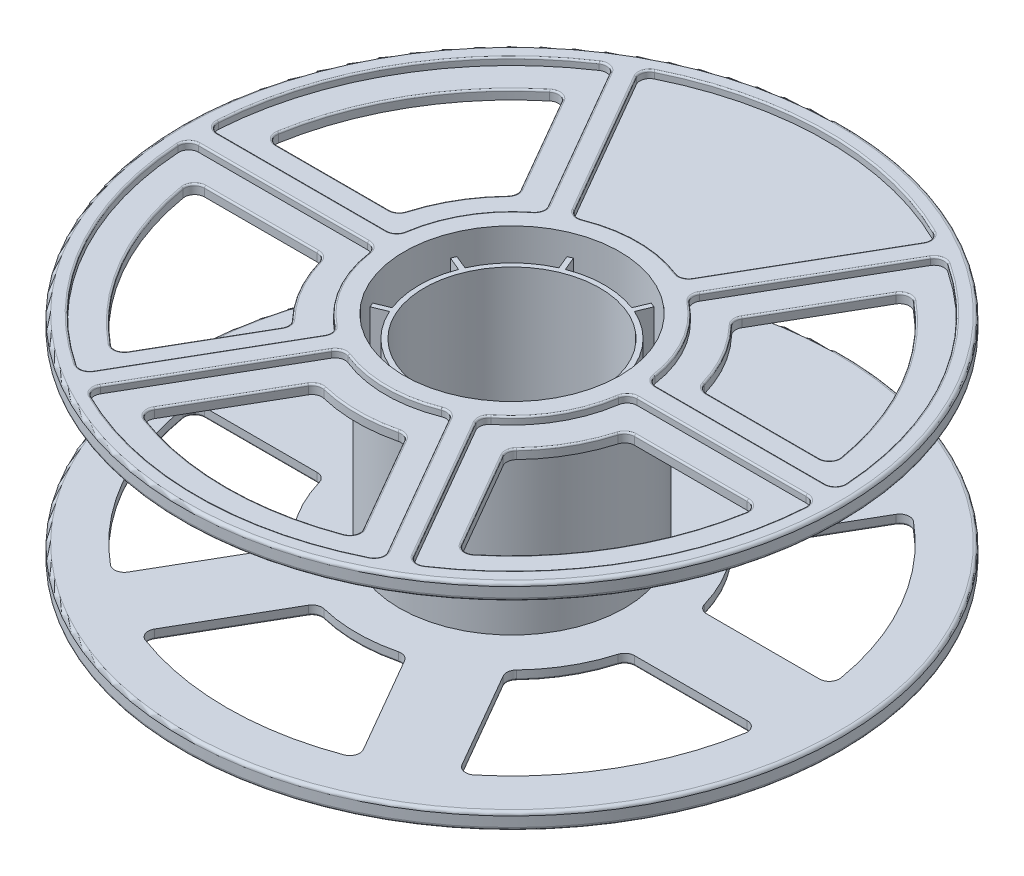
from build123d import *

# Parameters (mm, degrees)
SKETCH2_W                = 1.5
SKETCH2_H                = 52
INNER_START              = -52
INNER_RING_RIBS_DEPTH    = 52
TOP_PANEL_INSET_DEPTH    = 2.2
BOTTOM_START             = -2.2
BOTTOM_PANEL_INSET_DEPTH = 2.2
PANEL_CUTOUTS_DEPTH      = 155.091985515
UPPER_EDGE_FILLET_R      = 0.5
OUTER_RING_FILLET_R      = 1
PANEL_INSET_FILLET_R     = 0.5


with BuildPart() as part:
    # Sketch2 → Inner Ring (revolve)
    with BuildSketch(Plane.XY):
        with Locations((27.25, 0)):
            Rectangle(SKETCH2_W, SKETCH2_H)
    revolve(axis=Axis((0, -1000, 0), (0, 1, 0)))

    # Sketch3 → Inner Ring Ribs (add)
    with BuildSketch(Plane(origin=(0, 26, 0), x_dir=(1, 0, 0), z_dir=(0, 1, 0)).offset(INNER_START)):
        with BuildLine():
            Line((11.740989778, 30.305101205), (10.018381849, 26.146357779))
            ThreePointArc((10.018381849, 26.146357779), (10.715136106, 25.86862691), (11.404201147, 25.572332631))
            Line((11.404201147, 25.572332631), (13.126809077, 29.731076056))
            ThreePointArc((13.126809077, 29.731076056), (12.437211552, 30.026084807), (11.740989778, 30.305101205))
        make_face()
        with BuildLine():
            Line((29.731076056, 13.126809077), (25.572332631, 11.404201147))
            ThreePointArc((25.572332631, 11.404201147), (25.86862691, 10.715136106), (26.146357779, 10.018381849))
            Line((26.146357779, 10.018381849), (30.305101205, 11.740989778))
            ThreePointArc((30.305101205, 11.740989778), (30.026084807, 12.437211552), (29.731076056, 13.126809077))
        make_face()
        with BuildLine():
            Line((30.305101205, -11.740989778), (26.146357779, -10.018381849))
            ThreePointArc((26.146357779, -10.018381849), (25.86862691, -10.715136106), (25.572332631, -11.404201147))
            Line((25.572332631, -11.404201147), (29.731076056, -13.126809077))
            ThreePointArc((29.731076056, -13.126809077), (30.026084807, -12.437211552), (30.305101205, -11.740989778))
        make_face()
        with BuildLine():
            Line((13.126809077, -29.731076056), (11.404201147, -25.572332631))
            ThreePointArc((11.404201147, -25.572332631), (10.715136106, -25.86862691), (10.018381849, -26.146357779))
            Line((10.018381849, -26.146357779), (11.740989778, -30.305101205))
            ThreePointArc((11.740989778, -30.305101205), (12.437211552, -30.026084807), (13.126809077, -29.731076056))
        make_face()
        with BuildLine():
            Line((-11.740989778, -30.305101205), (-10.018381849, -26.146357779))
            ThreePointArc((-10.018381849, -26.146357779), (-10.715136106, -25.86862691), (-11.404201147, -25.572332631))
            Line((-11.404201147, -25.572332631), (-13.126809077, -29.731076056))
            ThreePointArc((-13.126809077, -29.731076056), (-12.437211552, -30.026084807), (-11.740989778, -30.305101205))
        make_face()
        with BuildLine():
            Line((-29.731076056, -13.126809077), (-25.572332631, -11.404201147))
            ThreePointArc((-25.572332631, -11.404201147), (-25.86862691, -10.715136106), (-26.146357779, -10.018381849))
            Line((-26.146357779, -10.018381849), (-30.305101205, -11.740989778))
            ThreePointArc((-30.305101205, -11.740989778), (-30.026084807, -12.437211552), (-29.731076056, -13.126809077))
        make_face()
        with BuildLine():
            Line((-30.305101205, 11.740989778), (-26.146357779, 10.018381849))
            ThreePointArc((-26.146357779, 10.018381849), (-25.86862691, 10.715136106), (-25.572332631, 11.404201147))
            Line((-25.572332631, 11.404201147), (-29.731076056, 13.126809077))
            ThreePointArc((-29.731076056, 13.126809077), (-30.026084807, 12.437211552), (-30.305101205, 11.740989778))
        make_face()
        with BuildLine():
            Line((-13.126809077, 29.731076056), (-11.404201147, 25.572332631))
            ThreePointArc((-11.404201147, 25.572332631), (-10.715136106, 25.86862691), (-10.018381849, 26.146357779))
            Line((-10.018381849, 26.146357779), (-11.740989778, 30.305101205))
            ThreePointArc((-11.740989778, 30.305101205), (-12.437211552, 30.026084807), (-13.126809077, 29.731076056))
        make_face()
    extrude(amount=INNER_RING_RIBS_DEPTH)

    # Sketch4 → Spool Panels (revolve)
    with BuildSketch(Plane.XY):
        Polygon((32.5, 32.5), (32.5, -32.5), (99.5, -32.5), (99.5, -27.5), (34, -27.5), (34, 27.5), (99.5, 27.5), (99.5, 32.5), align=None)
    revolve(axis=Axis((0, -1000, 0), (0, 1, 0)))

    # Sketch5 → Top Panel Inset (cut)
    with BuildSketch(Plane(origin=(0, 32.5, 0), x_dir=(1, 0, 0), z_dir=(0, 1, 0))):
        with BuildLine():
            Line((43.343733231, 80.873548145), (17.825684439, 36.674991128))
            ThreePointArc((17.825684439, 36.674991128), (16.210584243, 35.340602631), (14.116103978, 35.388495426))
            ThreePointArc((14.116103978, 35.388495426), (0, 38.1), (-14.116103978, 35.388495426))
            ThreePointArc((-14.116103978, 35.388495426), (-16.210584243, 35.340602631), (-17.825684439, 36.674991128))
            Line((-17.825684439, 36.674991128), (-43.343733231, 80.873548145))
            ThreePointArc((-43.343733231, 80.873548145), (-43.617002389, 83.24267171), (-42.075765518, 85.062564951))
            ThreePointArc((-42.075765518, 85.062564951), (0, 94.9), (42.075765518, 85.062564951))
            ThreePointArc((42.075765518, 85.062564951), (43.617002389, 83.24267171), (43.343733231, 80.873548145))
        make_face()
        with BuildLine():
            Line((91.710413803, 2.9), (40.67431622, 2.9))
            ThreePointArc((40.67431622, 2.9), (38.711151786, 3.631523551), (37.705388029, 5.469343066))
            ThreePointArc((37.705388029, 5.469343066), (32.995567884, 19.05), (23.589284051, 29.91915236))
            ThreePointArc((23.589284051, 29.91915236), (22.500567542, 31.709079081), (22.848631781, 33.774991128))
            Line((22.848631781, 33.774991128), (48.366680573, 77.973548145))
            ThreePointArc((48.366680573, 77.973548145), (50.281767186, 79.394767961), (52.628459399, 78.969964298))
            ThreePointArc((52.628459399, 78.969964298), (82.185810819, 47.45), (94.704224918, 6.092600653))
            ThreePointArc((94.704224918, 6.092600653), (93.898769574, 3.84790375), (91.710413803, 2.9))
        make_face()
        with BuildLine():
            Line((48.366680573, -77.973548145), (22.848631781, -33.774991128))
            ThreePointArc((22.848631781, -33.774991128), (22.500567542, -31.709079081), (23.589284051, -29.91915236))
            ThreePointArc((23.589284051, -29.91915236), (32.995567884, -19.05), (37.705388029, -5.469343066))
            ThreePointArc((37.705388029, -5.469343066), (38.711151786, -3.631523551), (40.67431622, -2.9))
            Line((40.67431622, -2.9), (91.710413803, -2.9))
            ThreePointArc((91.710413803, -2.9), (93.898769574, -3.84790375), (94.704224918, -6.092600653))
            ThreePointArc((94.704224918, -6.092600653), (82.185810819, -47.45), (52.628459399, -78.969964298))
            ThreePointArc((52.628459399, -78.969964298), (50.281767186, -79.394767961), (48.366680573, -77.973548145))
        make_face()
        with BuildLine():
            Line((-43.343733231, -80.873548145), (-17.825684439, -36.674991128))
            ThreePointArc((-17.825684439, -36.674991128), (-16.210584243, -35.340602631), (-14.116103978, -35.388495426))
            ThreePointArc((-14.116103978, -35.388495426), (0, -38.1), (14.116103978, -35.388495426))
            ThreePointArc((14.116103978, -35.388495426), (16.210584243, -35.340602631), (17.825684439, -36.674991128))
            Line((17.825684439, -36.674991128), (43.343733231, -80.873548145))
            ThreePointArc((43.343733231, -80.873548145), (43.617002389, -83.24267171), (42.075765518, -85.062564951))
            ThreePointArc((42.075765518, -85.062564951), (0, -94.9), (-42.075765518, -85.062564951))
            ThreePointArc((-42.075765518, -85.062564951), (-43.617002389, -83.24267171), (-43.343733231, -80.873548145))
        make_face()
        with BuildLine():
            Line((-91.710413803, -2.9), (-40.67431622, -2.9))
            ThreePointArc((-40.67431622, -2.9), (-38.711151786, -3.631523551), (-37.705388029, -5.469343066))
            ThreePointArc((-37.705388029, -5.469343066), (-32.995567884, -19.05), (-23.589284051, -29.91915236))
            ThreePointArc((-23.589284051, -29.91915236), (-22.500567542, -31.709079081), (-22.848631781, -33.774991128))
            Line((-22.848631781, -33.774991128), (-48.366680573, -77.973548145))
            ThreePointArc((-48.366680573, -77.973548145), (-50.281767186, -79.394767961), (-52.628459399, -78.969964298))
            ThreePointArc((-52.628459399, -78.969964298), (-82.185810819, -47.45), (-94.704224918, -6.092600653))
            ThreePointArc((-94.704224918, -6.092600653), (-93.898769574, -3.84790375), (-91.710413803, -2.9))
        make_face()
        with BuildLine():
            Line((-48.366680573, 77.973548145), (-22.848631781, 33.774991128))
            ThreePointArc((-22.848631781, 33.774991128), (-22.500567542, 31.709079081), (-23.589284051, 29.91915236))
            ThreePointArc((-23.589284051, 29.91915236), (-32.995567884, 19.05), (-37.705388029, 5.469343066))
            ThreePointArc((-37.705388029, 5.469343066), (-38.711151786, 3.631523551), (-40.67431622, 2.9))
            Line((-40.67431622, 2.9), (-91.710413803, 2.9))
            ThreePointArc((-91.710413803, 2.9), (-93.898769574, 3.84790375), (-94.704224918, 6.092600653))
            ThreePointArc((-94.704224918, 6.092600653), (-82.185810819, 47.45), (-52.628459399, 78.969964298))
            ThreePointArc((-52.628459399, 78.969964298), (-50.281767186, 79.394767961), (-48.366680573, 77.973548145))
        make_face()
    extrude(amount=-TOP_PANEL_INSET_DEPTH, mode=Mode.SUBTRACT)

    # Sketch7 → Bottom Panel Inset (cut)
    with BuildSketch(Plane.XZ.offset(32.5).offset(BOTTOM_START)):
        with BuildLine():
            Line((43.343733231, 80.873548145), (17.825684439, 36.674991128))
            ThreePointArc((17.825684439, 36.674991128), (16.210584243, 35.340602631), (14.116103978, 35.388495426))
            ThreePointArc((14.116103978, 35.388495426), (0, 38.1), (-14.116103978, 35.388495426))
            ThreePointArc((-14.116103978, 35.388495426), (-16.210584243, 35.340602631), (-17.825684439, 36.674991128))
            Line((-17.825684439, 36.674991128), (-43.343733231, 80.873548145))
            ThreePointArc((-43.343733231, 80.873548145), (-43.617002389, 83.24267171), (-42.075765518, 85.062564951))
            ThreePointArc((-42.075765518, 85.062564951), (0, 94.9), (42.075765518, 85.062564951))
            ThreePointArc((42.075765518, 85.062564951), (43.617002389, 83.24267171), (43.343733231, 80.873548145))
        make_face()
        with BuildLine():
            Line((91.710413803, 2.9), (40.67431622, 2.9))
            ThreePointArc((40.67431622, 2.9), (38.711151786, 3.631523551), (37.705388029, 5.469343066))
            ThreePointArc((37.705388029, 5.469343066), (32.995567884, 19.05), (23.589284051, 29.91915236))
            ThreePointArc((23.589284051, 29.91915236), (22.500567542, 31.709079081), (22.848631781, 33.774991128))
            Line((22.848631781, 33.774991128), (48.366680573, 77.973548145))
            ThreePointArc((48.366680573, 77.973548145), (50.281767186, 79.394767961), (52.628459399, 78.969964298))
            ThreePointArc((52.628459399, 78.969964298), (82.185810819, 47.45), (94.704224918, 6.092600653))
            ThreePointArc((94.704224918, 6.092600653), (93.898769574, 3.84790375), (91.710413803, 2.9))
        make_face()
        with BuildLine():
            Line((48.366680573, -77.973548145), (22.848631781, -33.774991128))
            ThreePointArc((22.848631781, -33.774991128), (22.500567542, -31.709079081), (23.589284051, -29.91915236))
            ThreePointArc((23.589284051, -29.91915236), (32.995567884, -19.05), (37.705388029, -5.469343066))
            ThreePointArc((37.705388029, -5.469343066), (38.711151786, -3.631523551), (40.67431622, -2.9))
            Line((40.67431622, -2.9), (91.710413803, -2.9))
            ThreePointArc((91.710413803, -2.9), (93.898769574, -3.84790375), (94.704224918, -6.092600653))
            ThreePointArc((94.704224918, -6.092600653), (82.185810819, -47.45), (52.628459399, -78.969964298))
            ThreePointArc((52.628459399, -78.969964298), (50.281767186, -79.394767961), (48.366680573, -77.973548145))
        make_face()
        with BuildLine():
            Line((-43.343733231, -80.873548145), (-17.825684439, -36.674991128))
            ThreePointArc((-17.825684439, -36.674991128), (-16.210584243, -35.340602631), (-14.116103978, -35.388495426))
            ThreePointArc((-14.116103978, -35.388495426), (0, -38.1), (14.116103978, -35.388495426))
            ThreePointArc((14.116103978, -35.388495426), (16.210584243, -35.340602631), (17.825684439, -36.674991128))
            Line((17.825684439, -36.674991128), (43.343733231, -80.873548145))
            ThreePointArc((43.343733231, -80.873548145), (43.617002389, -83.24267171), (42.075765518, -85.062564951))
            ThreePointArc((42.075765518, -85.062564951), (0, -94.9), (-42.075765518, -85.062564951))
            ThreePointArc((-42.075765518, -85.062564951), (-43.617002389, -83.24267171), (-43.343733231, -80.873548145))
        make_face()
        with BuildLine():
            Line((-91.710413803, -2.9), (-40.67431622, -2.9))
            ThreePointArc((-40.67431622, -2.9), (-38.711151786, -3.631523551), (-37.705388029, -5.469343066))
            ThreePointArc((-37.705388029, -5.469343066), (-32.995567884, -19.05), (-23.589284051, -29.91915236))
            ThreePointArc((-23.589284051, -29.91915236), (-22.500567542, -31.709079081), (-22.848631781, -33.774991128))
            Line((-22.848631781, -33.774991128), (-48.366680573, -77.973548145))
            ThreePointArc((-48.366680573, -77.973548145), (-50.281767186, -79.394767961), (-52.628459399, -78.969964298))
            ThreePointArc((-52.628459399, -78.969964298), (-82.185810819, -47.45), (-94.704224918, -6.092600653))
            ThreePointArc((-94.704224918, -6.092600653), (-93.898769574, -3.84790375), (-91.710413803, -2.9))
        make_face()
        with BuildLine():
            Line((-48.366680573, 77.973548145), (-22.848631781, 33.774991128))
            ThreePointArc((-22.848631781, 33.774991128), (-22.500567542, 31.709079081), (-23.589284051, 29.91915236))
            ThreePointArc((-23.589284051, 29.91915236), (-32.995567884, 19.05), (-37.705388029, 5.469343066))
            ThreePointArc((-37.705388029, 5.469343066), (-38.711151786, 3.631523551), (-40.67431622, 2.9))
            Line((-40.67431622, 2.9), (-91.710413803, 2.9))
            ThreePointArc((-91.710413803, 2.9), (-93.898769574, 3.84790375), (-94.704224918, 6.092600653))
            ThreePointArc((-94.704224918, 6.092600653), (-82.185810819, 47.45), (-52.628459399, 78.969964298))
            ThreePointArc((-52.628459399, 78.969964298), (-50.281767186, 79.394767961), (-48.366680573, 77.973548145))
        make_face()
    extrude(amount=BOTTOM_PANEL_INSET_DEPTH, mode=Mode.SUBTRACT)

    # Sketch8 → Panel Cutouts (cut, through all)
    with BuildSketch(Plane(origin=(0, 30.3, 0), x_dir=(1, 0, 0), z_dir=(0, 1, 0))):
        with BuildLine():
            Line((50.404295781, 65.502801213), (33.402147559, 36.054216653))
            ThreePointArc((33.402147559, 36.054216653), (33.022033256, 34.193133195), (33.835881659, 32.476808838))
            ThreePointArc((33.835881659, 32.476808838), (40.616591437, 23.45), (45.043682318, 13.064328657))
            ThreePointArc((45.043682318, 13.064328657), (46.12313861, 11.501353087), (47.924941315, 10.9))
            Line((47.924941315, 10.9), (81.92923776, 10.9))
            ThreePointArc((81.92923776, 10.9), (84.221116374, 11.964207548), (84.886971976, 14.401805054))
            ThreePointArc((84.886971976, 14.401805054), (74.564787266, 43.05), (54.915815025, 66.313371654))
            ThreePointArc((54.915815025, 66.313371654), (52.47186586, 66.955522541), (50.404295781, 65.502801213))
        make_face()
        with BuildLine():
            Line((81.92923776, -10.9), (47.924941315, -10.9))
            ThreePointArc((47.924941315, -10.9), (46.12313861, -11.501353087), (45.043682318, -13.064328657))
            ThreePointArc((45.043682318, -13.064328657), (40.616591437, -23.45), (33.835881659, -32.476808838))
            ThreePointArc((33.835881659, -32.476808838), (33.022033256, -34.193133195), (33.402147559, -36.054216653))
            Line((33.402147559, -36.054216653), (50.404295781, -65.502801213))
            ThreePointArc((50.404295781, -65.502801213), (52.47186586, -66.955522542), (54.915815025, -66.313371654))
            ThreePointArc((54.915815025, -66.313371654), (74.564787266, -43.05), (84.886971976, -14.401805054))
            ThreePointArc((84.886971976, -14.401805054), (84.221116374, -11.964207548), (81.92923776, -10.9))
        make_face()
        with BuildLine():
            Line((31.524941979, -76.402801213), (14.522793756, -46.954216653))
            ThreePointArc((14.522793756, -46.954216653), (13.101105354, -45.694486282), (11.207800658, -45.541137496))
            ThreePointArc((11.207800658, -45.541137496), (0, -46.9), (-11.207800658, -45.541137496))
            ThreePointArc((-11.207800658, -45.541137496), (-13.101105354, -45.694486282), (-14.522793756, -46.954216653))
            Line((-14.522793756, -46.954216653), (-31.524941979, -76.402801213))
            ThreePointArc((-31.524941979, -76.402801213), (-31.749250515, -78.919730089), (-29.971156951, -80.715176708))
            ThreePointArc((-29.971156951, -80.715176708), (0, -86.1), (29.971156951, -80.715176708))
            ThreePointArc((29.971156951, -80.715176708), (31.749250515, -78.919730089), (31.524941979, -76.402801213))
        make_face()
        with BuildLine():
            Line((-50.404295781, -65.502801213), (-33.402147559, -36.054216653))
            ThreePointArc((-33.402147559, -36.054216653), (-33.022033256, -34.193133195), (-33.835881659, -32.476808838))
            ThreePointArc((-33.835881659, -32.476808838), (-40.616591437, -23.45), (-45.043682318, -13.064328657))
            ThreePointArc((-45.043682318, -13.064328657), (-46.12313861, -11.501353087), (-47.924941315, -10.9))
            Line((-47.924941315, -10.9), (-81.92923776, -10.9))
            ThreePointArc((-81.92923776, -10.9), (-84.221116374, -11.964207548), (-84.886971976, -14.401805054))
            ThreePointArc((-84.886971976, -14.401805054), (-74.564787266, -43.05), (-54.915815025, -66.313371654))
            ThreePointArc((-54.915815025, -66.313371654), (-52.47186586, -66.955522541), (-50.404295781, -65.502801213))
        make_face()
        with BuildLine():
            Line((-81.92923776, 10.9), (-47.924941315, 10.9))
            ThreePointArc((-47.924941315, 10.9), (-46.12313861, 11.501353087), (-45.043682318, 13.064328657))
            ThreePointArc((-45.043682318, 13.064328657), (-40.616591437, 23.45), (-33.835881659, 32.476808838))
            ThreePointArc((-33.835881659, 32.476808838), (-33.022033256, 34.193133195), (-33.402147559, 36.054216653))
            Line((-33.402147559, 36.054216653), (-50.404295781, 65.502801213))
            ThreePointArc((-50.404295781, 65.502801213), (-52.47186586, 66.955522542), (-54.915815025, 66.313371654))
            ThreePointArc((-54.915815025, 66.313371654), (-74.564787266, 43.05), (-84.886971976, 14.401805054))
            ThreePointArc((-84.886971976, 14.401805054), (-84.221116374, 11.964207548), (-81.92923776, 10.9))
        make_face()
    extrude(amount=-PANEL_CUTOUTS_DEPTH, mode=Mode.SUBTRACT)

    # Upper Edge Fillet
    upper_edge_fillet_edges = [part.edges().sort_by_distance(p)[0] for p in [
        (16.210584243, 32.5, 35.340602631),
        (0, 32.5, 38.1),
        (-16.210584243, 32.5, 35.340602631),
        (-30.584708835, 32.5, 58.774269637),
        (-43.617002389, 32.5, 83.24267171),
        (0, 32.5, 94.9),
        (43.617002389, 32.5, 83.24267171),
        (30.584708835, 32.5, 58.774269637),
        (-22.500567542, 32.5, 31.709079081),
        (-32.995567884, 32.5, 19.05),
        (-38.711151786, 32.5, 3.631523551),
        (-66.192365012, 32.5, 2.9),
        (-93.898769574, 32.5, 3.84790375),
        (-82.185810819, 32.5, 47.45),
        (-50.281767186, 32.5, 79.394767961),
        (-35.607656177, 32.5, 55.874269637),
        (38.711151786, 32.5, 3.631523551),
        (32.995567884, 32.5, 19.05),
        (22.500567542, 32.5, 31.709079081),
        (35.607656177, 32.5, 55.874269637),
        (50.281767186, 32.5, 79.394767961),
        (82.185810819, 32.5, 47.45),
        (93.898769574, 32.5, 3.84790375),
        (66.192365012, 32.5, 2.9),
        (22.500567542, 32.5, -31.709079081),
        (32.995567884, 32.5, -19.05),
        (38.711151786, 32.5, -3.631523551),
        (66.192365012, 32.5, -2.9),
        (93.898769574, 32.5, -3.84790375),
        (82.185810819, 32.5, -47.45),
        (50.281767186, 32.5, -79.394767961),
        (35.607656177, 32.5, -55.874269637),
        (-38.711151786, 32.5, -3.631523551),
        (-32.995567884, 32.5, -19.05),
        (-22.500567542, 32.5, -31.709079081),
        (-35.607656177, 32.5, -55.874269637),
        (-50.281767186, 32.5, -79.394767961),
        (-82.185810819, 32.5, -47.45),
        (-93.898769574, 32.5, -3.84790375),
        (-66.192365012, 32.5, -2.9),
        (-16.210584243, 32.5, -35.340602631),
        (0, 32.5, -38.1),
        (16.210584243, 32.5, -35.340602631),
        (30.584708835, 32.5, -58.774269637),
        (43.617002389, 32.5, -83.24267171),
        (0, 32.5, -94.9),
        (-43.617002389, 32.5, -83.24267171),
        (-30.584708835, 32.5, -58.774269637),
        (16.210584243, -32.5, -35.340602631),
        (0, -32.5, -38.1),
        (-16.210584243, -32.5, -35.340602631),
        (-30.584708835, -32.5, -58.774269637),
        (-43.617002389, -32.5, -83.24267171),
        (0, -32.5, -94.9),
        (43.617002389, -32.5, -83.24267171),
        (30.584708835, -32.5, -58.774269637),
        (-22.500567542, -32.5, -31.709079081),
        (-32.995567884, -32.5, -19.05),
        (-38.711151786, -32.5, -3.631523551),
        (-66.192365012, -32.5, -2.9),
        (-93.898769574, -32.5, -3.84790375),
        (-82.185810819, -32.5, -47.45),
        (-50.281767186, -32.5, -79.394767961),
        (-35.607656177, -32.5, -55.874269637),
        (38.711151786, -32.5, -3.631523551),
        (32.995567884, -32.5, -19.05),
        (22.500567542, -32.5, -31.709079081),
        (35.607656177, -32.5, -55.874269637),
        (50.281767186, -32.5, -79.394767961),
        (82.185810819, -32.5, -47.45),
        (93.898769574, -32.5, -3.84790375),
        (66.192365012, -32.5, -2.9),
        (22.500567542, -32.5, 31.709079081),
        (32.995567884, -32.5, 19.05),
        (38.711151786, -32.5, 3.631523551),
        (66.192365012, -32.5, 2.9),
        (93.898769574, -32.5, 3.84790375),
        (82.185810819, -32.5, 47.45),
        (50.281767186, -32.5, 79.394767961),
        (35.607656177, -32.5, 55.874269637),
        (-38.711151786, -32.5, 3.631523551),
        (-32.995567884, -32.5, 19.05),
        (-22.500567542, -32.5, 31.709079081),
        (-35.607656177, -32.5, 55.874269637),
        (-50.281767186, -32.5, 79.394767961),
        (-82.185810819, -32.5, 47.45),
        (-93.898769574, -32.5, 3.84790375),
        (-66.192365012, -32.5, 2.9),
        (-16.210584243, -32.5, 35.340602631),
        (0, -32.5, 38.1),
        (16.210584243, -32.5, 35.340602631),
        (30.584708835, -32.5, 58.774269637),
        (43.617002389, -32.5, 83.24267171),
        (0, -32.5, 94.9),
        (-43.617002389, -32.5, 83.24267171),
        (-30.584708835, -32.5, 58.774269637),
    ]]
    fillet(upper_edge_fillet_edges, radius=UPPER_EDGE_FILLET_R)

    # Outer Ring Fillet
    outer_ring_fillet_edges = [part.edges().sort_by_distance(p)[0] for p in [
        (-99.5, 27.5, 0),
        (-99.5, 32.5, 0),
        (-99.5, -32.5, 0),
        (-99.5, -27.5, 0),
    ]]
    fillet(outer_ring_fillet_edges, radius=OUTER_RING_FILLET_R)

    # Panel Inset Fillet
    panel_inset_fillet_edges = [part.edges().sort_by_distance(p)[0] for p in [
        (-64.927089537, -30.3, -10.9),
        (-46.12313861, -30.3, -11.501353087),
        (-40.616591437, -30.3, -23.45),
        (-33.022033256, -30.3, -34.193133195),
        (-41.90322167, -30.3, -50.778508933),
        (-52.47186586, -30.3, -66.955522542),
        (-74.564787266, -30.3, -43.05),
        (-84.221116374, -30.3, -11.964207548),
        (41.90322167, -30.3, -50.778508933),
        (33.022033256, -30.3, -34.193133195),
        (40.616591437, -30.3, -23.45),
        (46.12313861, -30.3, -11.501353087),
        (64.927089537, -30.3, -10.9),
        (84.221116374, -30.3, -11.964207548),
        (74.564787266, -30.3, -43.05),
        (52.47186586, -30.3, -66.955522541),
        (64.927089537, -30.3, 10.9),
        (46.12313861, -30.3, 11.501353087),
        (40.616591437, -30.3, 23.45),
        (33.022033256, -30.3, 34.193133195),
        (41.90322167, -30.3, 50.778508933),
        (52.47186586, -30.3, 66.955522542),
        (74.564787266, -30.3, 43.05),
        (84.221116374, -30.3, 11.964207548),
        (-41.90322167, -30.3, 50.778508933),
        (-33.022033256, -30.3, 34.193133195),
        (-40.616591437, -30.3, 23.45),
        (-46.12313861, -30.3, 11.501353087),
        (-64.927089537, -30.3, 10.9),
        (-84.221116374, -30.3, 11.964207548),
        (-74.564787266, -30.3, 43.05),
        (-52.47186586, -30.3, 66.955522541),
        (23.023867867, -30.3, 61.678508933),
        (13.101105354, -30.3, 45.694486282),
        (0, -30.3, 46.9),
        (-13.101105354, -30.3, 45.694486282),
        (-23.023867867, -30.3, 61.678508933),
        (-31.749250515, -30.3, 78.919730089),
        (0, -30.3, 86.1),
        (31.749250515, -30.3, 78.919730089),
        (-40.616591437, 30.3, -23.45),
        (-84.221116374, 30.3, -11.964207548),
        (-64.927089537, 30.3, -10.9),
        (-46.12313861, 30.3, -11.501353087),
        (-33.022033256, 30.3, -34.193133195),
        (-41.90322167, 30.3, -50.778508933),
        (-52.47186586, 30.3, -66.955522542),
        (-74.564787266, 30.3, -43.05),
        (-40.616591437, 30.3, 23.45),
        (-52.47186586, 30.3, 66.955522541),
        (-41.90322167, 30.3, 50.778508933),
        (-33.022033256, 30.3, 34.193133195),
        (-46.12313861, 30.3, 11.501353087),
        (-64.927089537, 30.3, 10.9),
        (-84.221116374, 30.3, 11.964207548),
        (-74.564787266, 30.3, 43.05),
        (0, 30.3, 46.9),
        (31.749250515, 30.3, 78.919730089),
        (23.023867867, 30.3, 61.678508933),
        (13.101105354, 30.3, 45.694486282),
        (-13.101105354, 30.3, 45.694486282),
        (-23.023867867, 30.3, 61.678508933),
        (-31.749250515, 30.3, 78.919730089),
        (0, 30.3, 86.1),
        (40.616591437, 30.3, 23.45),
        (84.221116374, 30.3, 11.964207548),
        (64.927089537, 30.3, 10.9),
        (46.12313861, 30.3, 11.501353087),
        (33.022033256, 30.3, 34.193133195),
        (41.90322167, 30.3, 50.778508933),
        (52.47186586, 30.3, 66.955522542),
        (74.564787266, 30.3, 43.05),
        (40.616591437, 30.3, -23.45),
        (52.47186586, 30.3, -66.955522541),
        (41.90322167, 30.3, -50.778508933),
        (33.022033256, 30.3, -34.193133195),
        (46.12313861, 30.3, -11.501353087),
        (64.927089537, 30.3, -10.9),
        (84.221116374, 30.3, -11.964207548),
        (74.564787266, 30.3, -43.05),
    ]]
    fillet(panel_inset_fillet_edges, radius=PANEL_INSET_FILLET_R)


solid = part.part
